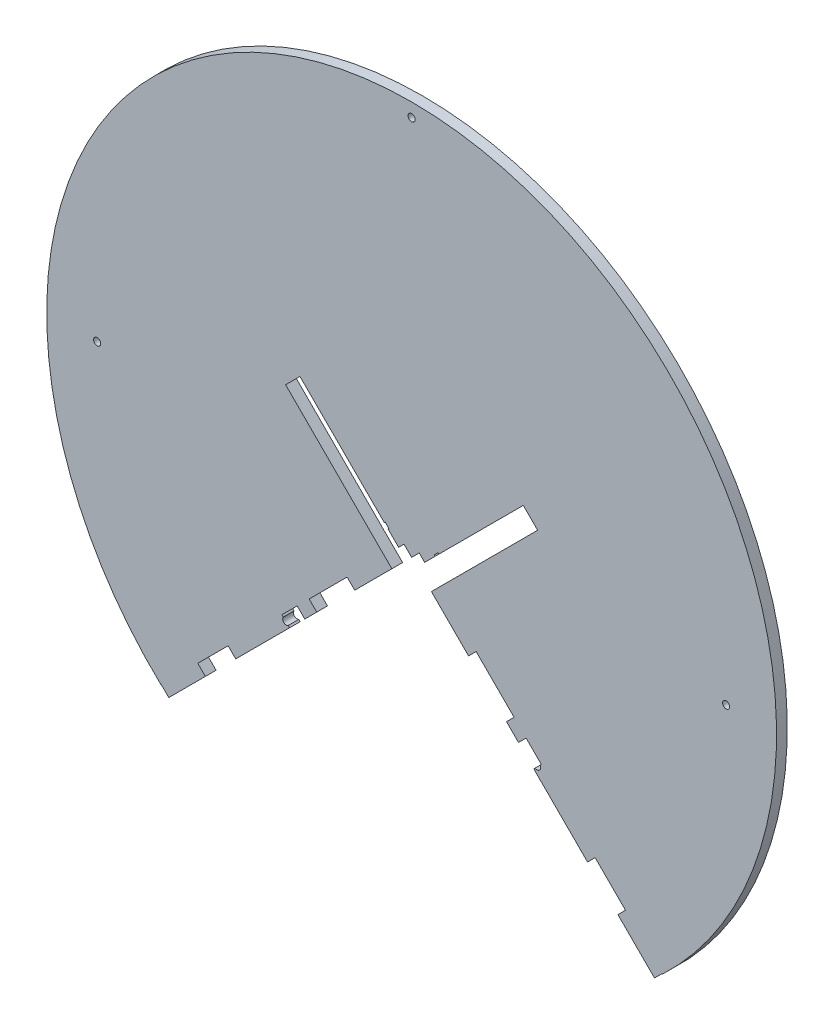
from build123d import *

# Parameters (mm, degrees)
SKETCH1_R           = 215.9
BOSS_EXTRUDE1_DEPTH = 6.35
CUT_EXTRUDE1_DEPTH  = 479.4246518
CUT_EXTRUDE2_DEPTH  = 431.278091265
SKETCH6_R           = 2.0955
CUT_EXTRUDE4_DEPTH  = 431.278091265
SKETCH7_R           = 2.0955
CUT_EXTRUDE5_DEPTH  = 431.278091265
CUT_EXTRUDE6_DEPTH  = 431.278091265
CUT_EXTRUDE7_DEPTH  = 431.278091265


with BuildPart() as part:
    # Sketch1 → Boss-Extrude1 (new body)
    with BuildSketch(Plane.XY):
        with Locations((0, -210.99227558)):
            Circle(SKETCH1_R)
    extrude(amount=BOSS_EXTRUDE1_DEPTH)

    # Sketch3 → Cut-Extrude1 (cut, through all)
    with BuildSketch(Plane(origin=(0, 0, 0), x_dir=(-1, 0, 0), z_dir=(0, 0, -1))):
        with BuildLine():
            Line((143.684097937, -372.137210344), (0, -228.453112406))
            Line((0, -228.453112406), (-143.684097937, -372.137210344))
            ThreePointArc((-143.684097937, -372.137210344), (0, -426.89227558), (143.684097937, -372.137210344))
        make_face()
    extrude(amount=-CUT_EXTRUDE1_DEPTH, mode=Mode.SUBTRACT)

    # Sketch4 → Cut-Extrude2 (cut, through all)
    with BuildSketch(Plane.XY.offset(6.35)):
        Polygon((-161.644610179, -390.097722586), (-166.13473824, -385.607594525), (-148.174225998, -367.647082283), (-143.684097937, -372.137210344), align=None)
        Polygon((-122.035533845, -350.488646252), (-126.525661906, -345.998518191), (-108.565149664, -328.038005949), (-104.075021603, -332.52813401), align=None)
        Polygon((-72.257974166, -300.711086573), (-76.748102227, -296.220958512), (-67.720111409, -287.192967694), (-63.229983348, -291.683095755), align=None)
        Polygon((-56.126600757, -284.579713163), (-60.616728817, -280.089585103), (-38.166088515, -257.6389448), (-33.675960454, -262.12907286), align=None)
        Polygon((-11.689323621, -240.142436027), (-16.179451682, -235.652307967), (-4.490128061, -223.962984346), (0, -228.453112406), align=None)
    cut_extrude2 = extrude(amount=-CUT_EXTRUDE2_DEPTH, mode=Mode.SUBTRACT)

    # Mirror1: Cut-Extrude2 across plane
    add(cut_extrude2.mirror(Plane(origin=(0, 0, 0), x_dir=(0, 0, 1), z_dir=(1, 0, 0))), mode=Mode.SUBTRACT)

    # Sketch6 → Cut-Extrude4 (cut, through all)
    with BuildSketch(Plane.XY.offset(6.35)):
        with Locations((-172.869930331, -396.832914676)):
            Circle(SKETCH6_R)
        with Locations((-74.182582392, -298.145566738)):
            Circle(SKETCH6_R)
    cut_extrude4 = extrude(amount=-CUT_EXTRUDE4_DEPTH, mode=Mode.SUBTRACT)

    # Mirror2: Cut-Extrude4 across plane
    add(cut_extrude4.mirror(Plane(origin=(0, 0, 0), x_dir=(0, 0, 1), z_dir=(1, 0, 0))), mode=Mode.SUBTRACT)

    # Sketch7 → Cut-Extrude5 (cut, through all)
    with BuildSketch(Plane.XY.offset(6.35)):
        with Locations((-186.055, -210.99227558)):
            Circle(SKETCH7_R)
        with Locations((0, -3.175)):
            Circle(SKETCH7_R)
        with Locations((186.055, -210.99227558)):
            Circle(SKETCH7_R)
    extrude(amount=-CUT_EXTRUDE5_DEPTH, mode=Mode.SUBTRACT)

    # Sketch8 → Cut-Extrude6 (cut, through all)
    with BuildSketch(Plane.XY.offset(6.35)):
        Polygon((-3.208742916, -231.661855322), (-11.689323621, -240.142436027), (-74.551116468, -177.28064318), (-66.070535763, -168.800062475), align=None)
    cut_extrude6 = extrude(amount=-CUT_EXTRUDE6_DEPTH, mode=Mode.SUBTRACT)

    # Mirror3: Cut-Extrude6 across plane
    add(cut_extrude6.mirror(Plane(origin=(0, 0, 0), x_dir=(0, 0, 1), z_dir=(1, 0, 0))), mode=Mode.SUBTRACT)

    # Sketch9 → Cut-Extrude7 (cut, through all)
    with BuildSketch(Plane.XY.offset(6.35)):
        Polygon((-11.843472899, -231.316329185), (-8.826106843, -228.298963128), (-15.022483566, -222.102586405), (-13.388076952, -220.46817979), (-15.633140982, -218.22311576), (-17.267547597, -219.857522374), (-19.602414188, -217.522655783), (-22.619780245, -220.540021839), (-20.284913653, -222.874888431), (-21.919320267, -224.509295045), (-19.674256237, -226.754359075), (-18.039849623, -225.119952461), align=None)
    cut_extrude7 = extrude(amount=-CUT_EXTRUDE7_DEPTH, mode=Mode.SUBTRACT)

    # Mirror4: Cut-Extrude7 across plane
    add(cut_extrude7.mirror(Plane(origin=(0, 0, 0), x_dir=(0, 0, 1), z_dir=(1, 0, 0))), mode=Mode.SUBTRACT)


solid = part.part
